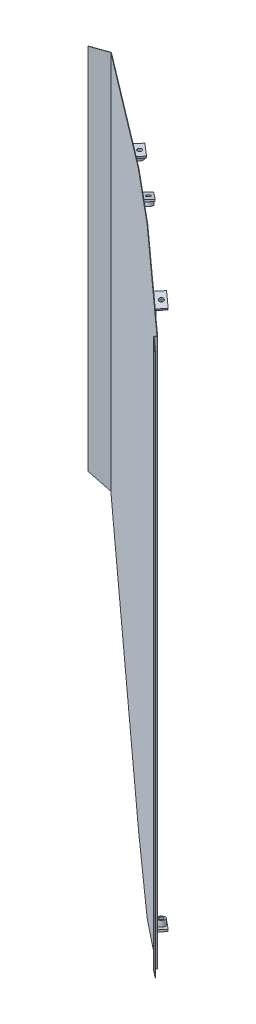
from build123d import *

# Parameters (mm, degrees)
WYCI_GNI_CIE_CIENKA_CIANKA1_DEPTH      = 400
WYCI_GNI_CIE_CIENKA_CIANKA1_DEPTH_BACK = 400
LUSTRO2_START                          = 277.039042492
LUSTRO2_DEPTH                          = 3.5
DODANIE_WYCI_GNI_CIE1_DEPTH            = 2
WYCI_GNI_CIE_CIENKA_CIANKA2_DEPTH      = 10
SZKIC12_R                              = 2.5
WYTNIJ_WYCI_GNI_CIE1_DEPTH             = 6
DODANIE_WYCI_GNI_CIE2_DEPTH            = 2
WYCI_GNI_CIE_CIENKA_CIANKA3_DEPTH      = 10
SZKIC16_R                              = 2.5
WYTNIJ_WYCI_GNI_CIE2_DEPTH             = 6
DODANIE_WYCI_GNI_CIE3_DEPTH            = 2
WYCI_GNI_CIE_CIENKA_CIANKA4_DEPTH      = 10
SZKIC19_R                              = 2.5
WYTNIJ_WYCI_GNI_CIE3_DEPTH             = 6
EXTRUDE_THIN1_START                    = 6
SZKIC19_2_R                            = 4.5
SZKIC19_2_R_2                          = 2.5
EXTRUDE_THIN1_DEPTH                    = 6
EXTRUDE_THIN2_START                    = 6
SZKIC16_2_R                            = 4.5
SZKIC16_2_R_2                          = 2.5
EXTRUDE_THIN2_DEPTH                    = 6
EXTRUDE_THIN3_START                    = 6
SZKIC12_2_R                            = 4.5
SZKIC12_2_R_2                          = 2.5
EXTRUDE_THIN3_DEPTH                    = 6


# Read off the part's stored shape, not the designer's step: Lustro2
with BuildPart() as part:
    # Szkic1 → Wyciągnięcie-cienka ścianka1 (new, two sides: drawn at the far end of the back side and taken through both)
    with BuildSketch(Plane(origin=(0, 0, 0), x_dir=(1, 0, 0), z_dir=(0, 1, 0)).offset(-WYCI_GNI_CIE_CIENKA_CIANKA1_DEPTH_BACK)):
        Polygon((972.134722106, -477.320983834), (957.040530502, -464.199803255), (959.008707589, -461.935674514), (958.253998008, -461.279615485), (545, -102.043395667), (517.881642578, -102.043395667), (517.881642578, -102.543395667), (544.81305766, -102.543395667), (957.925968494, -461.656970275), (958.303323284, -461.98499979), (956.335146197, -464.24912853), (971.806692592, -477.698338624), align=None)
    extrude(amount=WYCI_GNI_CIE_CIENKA_CIANKA1_DEPTH + WYCI_GNI_CIE_CIENKA_CIANKA1_DEPTH_BACK)

    # Cięcie powierzchnią2
    split(bisect_by=Plane(origin=(-13.122082675, 50.268990001, -11.406852442), x_dir=(0.6328754019355285, 0.32469887066665293, 0.7028793417171568), z_dir=(0.24669767629086262, -0.945066673459785, 0.21445101824972695)), keep=Keep.TOP)

    # Cięcie powierzchnią3
    split(bisect_by=Plane(origin=(-13.795060398, -53.64380516, -11.991863051), x_dir=(-0.7143770117085512, 0.3225312314146349, -0.6209984620790296), z_dir=(-0.24341741026967303, -0.9465588226635253, -0.21159952650099761)), keep=Keep.BOTTOM)

    # Cięcie powierzchnią4
    split(bisect_by=Plane(origin=(-24.349944471, -199.016868, -21.167083796), x_dir=(0.7449832908348125, -0.1600276007809854, 0.6476040946173941), z_dir=(-0.12077436340947467, -0.987112540183885, -0.10498755238005406)), keep=Keep.BOTTOM)

    # Cięcie powierzchnią5
    split(bisect_by=Plane(origin=(110.843151094, -553.888363867, 96.354481224), x_dir=(0.7294998198065532, 0.25630205312360615, 0.6341445185971655), z_dir=(0.19343361492315114, -0.9665967398893007, 0.1681492761005468)), keep=Keep.BOTTOM)

    # Lustro2 outline → Lustro2 (cut)
    with BuildSketch(Plane(origin=(0, 0, 0), x_dir=(0.754709580222771, 0, 0.6560590289905086), z_dir=(0.6560590289905085, 0, -0.754709580222771)).offset(LUSTRO2_START)):
        Polygon((909.445947287, -351.683941116), (805.20178126, -334.784202631), (993.753311489, -400), (1046.830129212, -400), (1046.830129212, -315.255256391), align=None)
    extrude(amount=LUSTRO2_DEPTH, mode=Mode.SUBTRACT)

    # Szkic10 → Dodanie-wyciągnięcie1 (add)
    with BuildSketch(Plane(origin=(184.050171811, 0, -211.725502995), x_dir=(-0.7547095802227711, 0, -0.6560590289905084), z_dir=(0.6560590289905084, 0, -0.7547095802227711))):
        Polygon((-723.785887875, -289.14803149), (-703.807733048, -288.213510375), (-704.274993606, -278.224432962), (-724.253148432, -279.158954077), align=None)
    dodanie_wyci_gni_cie1 = extrude(amount=DODANIE_WYCI_GNI_CIE1_DEPTH)

    # Szkic11 → Wyciągnięcie-cienka ścianka2 (add)
    with BuildSketch(Plane(origin=(185.362289869, 0, -213.234922155), x_dir=(-0.7547095802227721, 0, -0.6560590289905072), z_dir=(0.6560590289905072, 0, -0.7547095802227721))):
        Polygon((-723.785887875, -289.14803149), (-703.807733048, -288.213510375), (-703.901185159, -286.215694893), (-723.879339986, -287.150216008), align=None)
    wyci_gni_cie_cienka_cianka2 = extrude(amount=WYCI_GNI_CIE_CIENKA_CIANKA2_DEPTH)

    # Szkic12 → Wytnij-wyciągnięcie1 (cut)
    with BuildSketch(Plane(origin=(-8.922386764, -252.736192146, -7.756112483), x_dir=(0.9993780104898576, -0.03524800775504095, -0.0010817109755482265), z_dir=(0.035264601930747055, 0.9989077413419046, 0.030655050772765847))):
        with Locations(Location((736.803075954, -260.021158903, 0), (0, 0, 179.937993373))):
            Circle(SZKIC12_R)
    wytnij_wyci_gni_cie1 = extrude(amount=-WYTNIJ_WYCI_GNI_CIE1_DEPTH, mode=Mode.SUBTRACT)

    # Szkic14 → Dodanie-wyciągnięcie2 (add)
    with BuildSketch(Plane(origin=(184.050171811, 0, -211.725502995), x_dir=(-0.7547095802227711, 0, -0.6560590289905084), z_dir=(0.6560590289905084, 0, -0.7547095802227711))):
        Polygon((-826.154339771, -317.666675693), (-807.050007897, -311.748525334), (-810.009083077, -302.196359397), (-829.11341495, -308.114509757), align=None)
    dodanie_wyci_gni_cie2 = extrude(amount=DODANIE_WYCI_GNI_CIE2_DEPTH)

    # Szkic15 → Wyciągnięcie-cienka ścianka3 (add)
    with BuildSketch(Plane(origin=(185.362289869, 0, -213.234922155), x_dir=(-0.7547095802227656, 8.492898931658996e-15, -0.6560590289905148), z_dir=(0.6560590289905147, 9.769962616701384e-15, -0.7547095802227655))):
        Polygon((-826.154339771, -317.666675693), (-807.050007897, -311.748525334), (-807.641822933, -309.838092146), (-826.746154807, -315.756242506), align=None)
    wyci_gni_cie_cienka_cianka3 = extrude(amount=WYCI_GNI_CIE_CIENKA_CIANKA3_DEPTH)

    # Szkic16 → Wytnij-wyciągnięcie2 (cut)
    with BuildSketch(Plane(origin=(-12.723943102, -54.423656206, -11.060754992), x_dir=(0.9747442148680406, -0.21885025353139564, -0.04447788338636554), z_dir=(0.22332423867840068, 0.9552165936601662, 0.1941327989160557))):
        with Locations(Location((839.308044037, -375.023490092, 0), (0, 0, 177.401291281))):
            Circle(SZKIC16_R)
    wytnij_wyci_gni_cie2 = extrude(amount=-WYTNIJ_WYCI_GNI_CIE2_DEPTH, mode=Mode.SUBTRACT)

    # Szkic17 → Dodanie-wyciągnięcie3 (add)
    with BuildSketch(Plane(origin=(184.050171811, 0, -211.725502995), x_dir=(-0.7547095802227711, 0, -0.6560590289905084), z_dir=(0.6560590289905084, 0, -0.7547095802227711))):
        Polygon((-980.419174897, -315.823054253), (-960.869985355, -320.045516598), (-958.758754182, -310.270921827), (-978.307943724, -306.048459483), align=None)
    dodanie_wyci_gni_cie3 = extrude(amount=DODANIE_WYCI_GNI_CIE3_DEPTH)

    # Szkic18 → Wyciągnięcie-cienka ścianka4 (add)
    with BuildSketch(Plane(origin=(185.362289869, 0, -213.234922155), x_dir=(-0.7547095802227731, -3.9689825973234995e-15, -0.656059028990506), z_dir=(0.656059028990506, -4.565792188770957e-15, -0.7547095802227731))):
        Polygon((-980.419174897, -315.823054253), (-960.869985355, -320.045516598), (-960.44773912, -318.090597644), (-979.996928662, -313.868135299), align=None)
    wyci_gni_cie_cienka_cianka4 = extrude(amount=WYCI_GNI_CIE_CIENKA_CIANKA4_DEPTH)

    # Szkic19 → Wytnij-wyciągnięcie3 (cut)
    with BuildSketch(Plane(origin=(81.850178316, -502.114472254, 71.151274498), x_dir=(0.9872243085600819, 0.15776060888456483, -0.022355197884150288), z_dir=(-0.15933663918907087, 0.9774594770966201, -0.138509227295274))):
        with Locations(Location((849.886383223, -371.032714173, 0), (0, 0, 178.706565483))):
            Circle(SZKIC19_R)
    wytnij_wyci_gni_cie3 = extrude(amount=-WYTNIJ_WYCI_GNI_CIE3_DEPTH, mode=Mode.SUBTRACT)

    # Szkic19<2> → Extrude-Thin1 (add)
    with BuildSketch(Plane(origin=(81.850178316, -502.114472254, 71.151274498), x_dir=(0.9872243085600819, 0.15776060888456483, -0.022355197884150288), z_dir=(-0.15933663918907087, 0.9774594770966201, -0.138509227295274)).offset(EXTRUDE_THIN1_START)):
        with Locations((849.886383223, -371.032714173)):
            Circle(SZKIC19_2_R)
        with Locations((849.886383223, -371.032714173)):
            Circle(SZKIC19_2_R_2, mode=Mode.SUBTRACT)
    extrude_thin1 = extrude(amount=-EXTRUDE_THIN1_DEPTH)

    # Szkic16<2> → Extrude-Thin2 (add)
    with BuildSketch(Plane(origin=(-12.723943102, -54.423656206, -11.060754992), x_dir=(0.9747442148680406, -0.21885025353139564, -0.04447788338636554), z_dir=(0.22332423867840068, 0.9552165936601662, 0.1941327989160557)).offset(EXTRUDE_THIN2_START)):
        with Locations((839.308044037, -375.023490092)):
            Circle(SZKIC16_2_R)
        with Locations((839.308044037, -375.023490092)):
            Circle(SZKIC16_2_R_2, mode=Mode.SUBTRACT)
    extrude_thin2 = extrude(amount=-EXTRUDE_THIN2_DEPTH)

    # Szkic12<2> → Extrude-Thin3 (add)
    with BuildSketch(Plane(origin=(-8.922386764, -252.736192146, -7.756112483), x_dir=(0.9993780104898576, -0.03524800775504095, -0.0010817109755482265), z_dir=(0.035264601930747055, 0.9989077413419046, 0.030655050772765847)).offset(EXTRUDE_THIN3_START)):
        with Locations((736.803075954, -260.021158903)):
            Circle(SZKIC12_2_R)
        with Locations((736.803075954, -260.021158903)):
            Circle(SZKIC12_2_R_2, mode=Mode.SUBTRACT)
    extrude_thin3 = extrude(amount=-EXTRUDE_THIN3_DEPTH)

    # Lustro3: Dodanie-wyciągnięcie1, Wyciągnięcie-cienka ścianka2, Wytnij-wyciągnięcie1, Dodanie-wyciągnięcie2, Wyciągnięcie-cienka ścianka3, Wytnij-wyciągnięcie2, Dodanie-wyciągnięcie3, Wyciągnięcie-cienka ścianka4, Wytnij-wyciągnięcie3, Extrude-Thin1, Extrude-Thin2, Extrude-Thin3 across plane
    add(dodanie_wyci_gni_cie1.mirror(Plane.ZX))
    add(wyci_gni_cie_cienka_cianka2.mirror(Plane.ZX))
    add(wytnij_wyci_gni_cie1.mirror(Plane.ZX), mode=Mode.SUBTRACT)
    add(dodanie_wyci_gni_cie2.mirror(Plane.ZX))
    add(wyci_gni_cie_cienka_cianka3.mirror(Plane.ZX))
    add(wytnij_wyci_gni_cie2.mirror(Plane.ZX), mode=Mode.SUBTRACT)
    add(dodanie_wyci_gni_cie3.mirror(Plane.ZX))
    add(wyci_gni_cie_cienka_cianka4.mirror(Plane.ZX))
    add(wytnij_wyci_gni_cie3.mirror(Plane.ZX), mode=Mode.SUBTRACT)
    add(extrude_thin1.mirror(Plane.ZX))
    add(extrude_thin2.mirror(Plane.ZX))
    add(extrude_thin3.mirror(Plane.ZX))


solid = part.part
